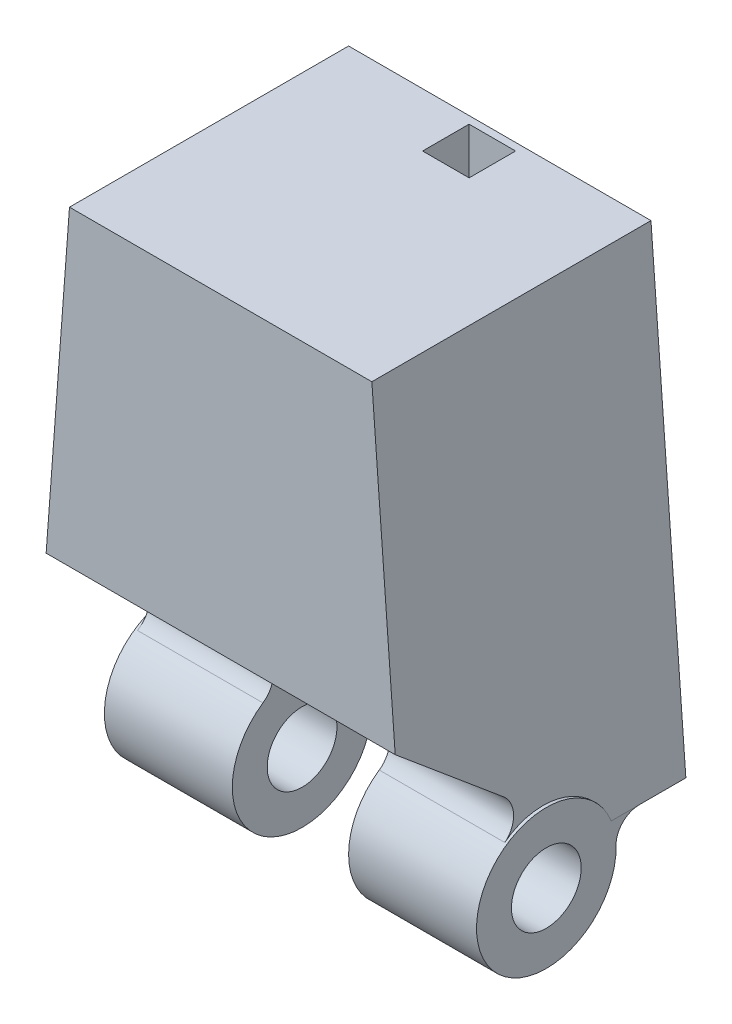
from build123d import *
from build123d.topology import SkipClean

# Parameters (mm, degrees)
BOSS_EXTRUDE1_DEPTH     = 12
CUT_EXTRUDE1_DEPTH      = 22.914607001
CUT_EXTRUDE1_DEPTH_BACK = 22.914607001
SKETCH4_R               = 3
SKETCH4_R_2             = 1.5
BOSS_EXTRUDE2_DEPTH     = 8
SKETCH5_R               = 3
SKETCH5_R_2             = 1.5
CUT_EXTRUDE2_DEPTH      = 2.5
FILLET1_R               = 1
FILLET2_R               = 1
CUT_EXTRUDE3_DEPTH      = 22.914607001
CUT_EXTRUDE3_DEPTH_BACK = 22.914607001
SKETCH6_W               = 12
SKETCH6_H               = 6.5
CUT_EXTRUDE4_DEPTH      = 5
BOSS_EXTRUDE3_REACH     = 24.623
SKETCH8_R               = 1.5
SKETCH9_W               = 2
SKETCH9_H               = 33.212886517
CUT_EXTRUDE5_DEPTH      = 1


with BuildPart() as part:
    # Sketch1 → Boss-Extrude1 (new body)
    with BuildSketch(Plane.XY):
        with BuildLine():
            Line((-8, -10), (8, -10))
            Line((8, -10), (6.5, 10))
            ThreePointArc((6.5, 10), (0, 16.5), (-6.5, 10))
            Line((-6.5, 10), (-8, -10))
        make_face()
    extrude(amount=BOSS_EXTRUDE1_DEPTH)

    # Sketch3 → Cut-Extrude1 (cut, two sides: drawn at the far end of the back side and taken through both)
    with BuildSketch(Plane(origin=(0, 0, 0), x_dir=(0, 0, -1), z_dir=(1, 0, 0)).offset(-CUT_EXTRUDE1_DEPTH_BACK)):
        Polygon((-4, -10), (-12, -3.386045056), (-12, -10), align=None)
    extrude(amount=CUT_EXTRUDE1_DEPTH + CUT_EXTRUDE1_DEPTH_BACK, mode=Mode.SUBTRACT)

    # Sketch4 → Boss-Extrude2 (add, symmetric)
    with BuildSketch(Plane(origin=(0, 0, 0), x_dir=(0, 0, -1), z_dir=(1, 0, 0))):
        with Locations((-6, -11.1)):
            Circle(SKETCH4_R)
        with Locations((-6, -11.1)):
            Circle(SKETCH4_R_2, mode=Mode.SUBTRACT)
    extrude(amount=BOSS_EXTRUDE2_DEPTH, both=True)

    # Sketch5 → Cut-Extrude2 (cut, symmetric)
    with SkipClean():  # the faces are left unmerged after this step: merging them gives an invalid solid
        with BuildSketch(Plane(origin=(0, 0, 0), x_dir=(0, 0, -1), z_dir=(1, 0, 0))):
            with Locations((-6, -11.1)):
                Circle(SKETCH5_R)
            with Locations((-6, -11.1)):
                Circle(SKETCH5_R_2, mode=Mode.SUBTRACT)
        extrude(amount=CUT_EXTRUDE2_DEPTH, both=True, mode=Mode.SUBTRACT)

    # Fillet1
    fillet1_edges = [part.edges().sort_by_distance(p)[0] for p in [
        (5.179248458, -8.113292219, 6.282093298),
        (-5.179248458, -8.113292219, 6.282093298),
    ]]
    fillet(fillet1_edges, radius=FILLET1_R)

    # Fillet2
    # the kernel refuses this fillet: 1 mm, written as the material it adds along each edge
    with BuildSketch(Plane(origin=(-8, -10, 3.208942853), x_dir=(0, 0, -1), z_dir=(1, 0, 0)), Plane(origin=(2.5, -10, 3.208942853), x_dir=(0, 0, -1), z_dir=(1, 0, 0))) as fillet2_piece_1:
        with BuildLine():
            CenterArc((1.207692657, -1), FILLET2_R, 90, 91.432543738)
            ThreePointArc((0.208005206, -1.025), (0.149015506, -0.503365446), (0, 0))
            Line((0, 0), (1.207692657, 0))
        make_face()
    extrude(amount=5.5)

    # Sketch6 → Cut-Extrude3 (cut, two sides: drawn at the far end of the back side and taken through both)
    with BuildSketch(Plane(origin=(0, 0, 0), x_dir=(0, 0, -1), z_dir=(1, 0, 0)).offset(-CUT_EXTRUDE3_DEPTH_BACK)):
        with Locations((-6, 13.25)):
            Rectangle(SKETCH6_W, SKETCH6_H)
    extrude(amount=CUT_EXTRUDE3_DEPTH + CUT_EXTRUDE3_DEPTH_BACK, mode=Mode.SUBTRACT)

    # Sketch7 → Cut-Extrude4 (cut)
    with BuildSketch(Plane(origin=(0, -7.904323178, 6.53485467), x_dir=(1, 0, 0), z_dir=(0, -0.770712909441233, 0.6371825572162423))):
        Polygon((-5, 5.891026066), (0, 5.891026066), (5, 5.891026066), (5, 1.891026066), (-5, 1.891026066), align=None)
    extrude(amount=-CUT_EXTRUDE4_DEPTH, mode=Mode.SUBTRACT)

    # Sketch8 → Boss-Extrude3 (add, up to next)
    with BuildSketch(Plane(origin=(-5, 0, 0), x_dir=(0, 0, -1), z_dir=(1, 0, 0)), mode=Mode.PRIVATE) as boss_extrude3_sk1:
        with Locations(Location((-7.940762297, -3.498246966, 0), (0, 0, 180))):
            Circle(SKETCH8_R)
    boss_extrude3_tool1 = extrude(boss_extrude3_sk1.sketch, amount=BOSS_EXTRUDE3_REACH, mode=Mode.PRIVATE) - part.part
    add(boss_extrude3_tool1.solids().sort_by_distance((-5, -3.498247, 7.940762))[0])

    # Sketch9 → Cut-Extrude5 (cut, symmetric)
    with BuildSketch(Plane(origin=(0, 0, 0), x_dir=(0, 0, -1), z_dir=(1, 0, 0))):
        with Locations((-1.32, 6.606443259)):
            Rectangle(SKETCH9_W, SKETCH9_H)
    extrude(amount=CUT_EXTRUDE5_DEPTH, both=True, mode=Mode.SUBTRACT)


solid = part.part
